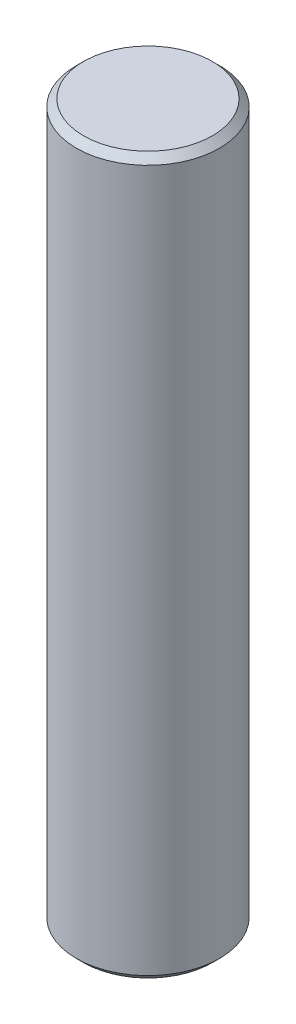
from build123d import *

# Parameters (mm, degrees)
SKETCH1_R           = 3
BOSS_EXTRUDE1_DEPTH = 30
CHAMFER1_SIZE       = 0.3


with BuildPart() as part:
    # Sketch1 → Boss-Extrude1 (new body)
    with BuildSketch(Plane(origin=(0, 0, 0), x_dir=(1, 0, 0), z_dir=(0, 1, 0))):
        Circle(SKETCH1_R)
    extrude(amount=BOSS_EXTRUDE1_DEPTH)

    # Chamfer1
    chamfer1_edges = [part.edges().sort_by_distance(p)[0] for p in [
        (-3, 30, 0),
        (-3, 0, 0),
    ]]
    chamfer(chamfer1_edges, length=CHAMFER1_SIZE)


solid = part.part
